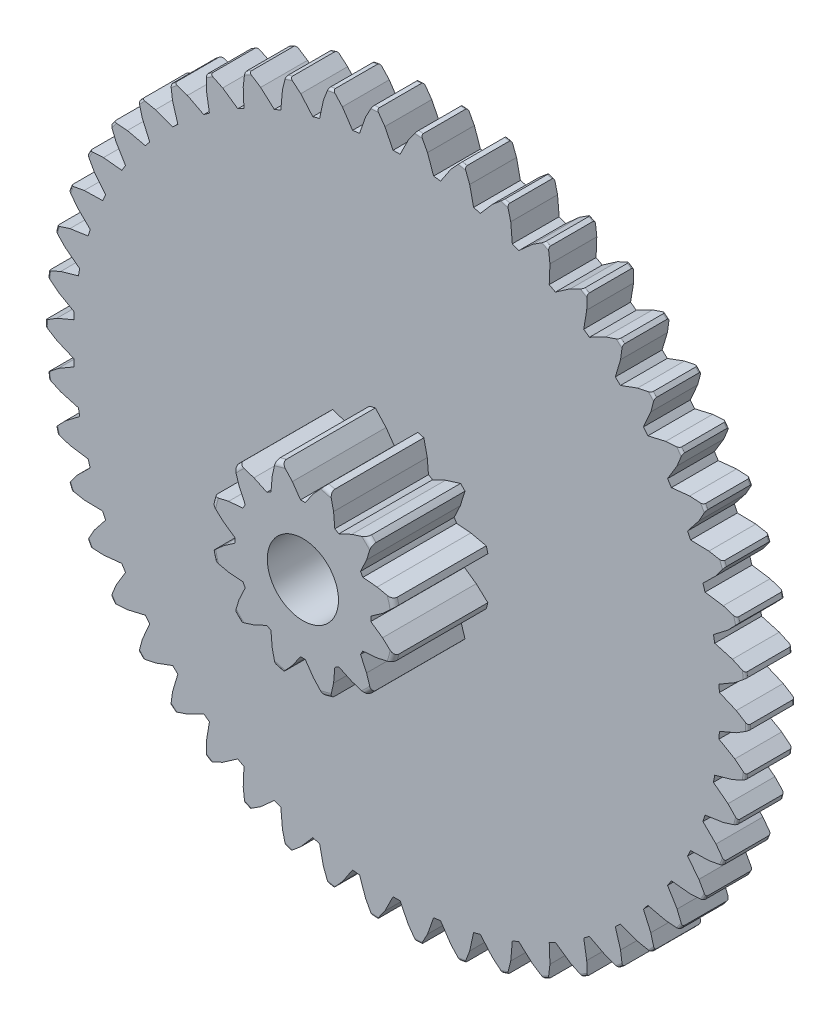
from build123d import *

# Parameters (mm, degrees)
CROQUIS1_R              = 7.5
SALIENTE_EXTRUIR1_DEPTH = 1
CROQUIS3_R              = 2
SALIENTE_EXTRUIR2_DEPTH = 2
CORTAR_EXTRUIR5_DEPTH   = 3
REDONDEO2_R             = 0.05
MATRIZC3_COUNT          = 50
CORTAR_EXTRUIR6_START   = -2
CORTAR_EXTRUIR6_DEPTH   = 2
REDONDEO1_R             = 0.1
MATRIZC4_COUNT          = 12
CROQUIS5_4_R            = 0.76
CORTAR_EXTRUIR8_DEPTH   = 3


with BuildPart() as part:
    # Croquis1 → Saliente-Extruir1 (new body)
    with BuildSketch(Plane.XY):
        Circle(CROQUIS1_R)
    extrude(amount=SALIENTE_EXTRUIR1_DEPTH)

    # Croquis3 → Saliente-Extruir2 (add)
    with BuildSketch(Plane.XY.offset(1)):
        Circle(CROQUIS3_R)
    extrude(amount=SALIENTE_EXTRUIR2_DEPTH)

    # Croquis4 → Cortar-Extruir5 (cut)
    with BuildSketch(Plane.XY.offset(3)):
        with BuildLine():
            Line((0.5, 7.6000000000000005), (-0.5, 7.6000000000000005))
            Line((-0.5, 7.6000000000000005), (-0.25, 7.25))
            Line((-0.25, 7.25), (-0.07500000000000001, 6.899592379264156))
            ThreePointArc((-0.07500000000000011, 6.8995923792641545), (4.2e-16, 6.9), (0.07499999999999943, 6.8995923792641545))
            Line((0.07500000000000001, 6.899592379264156), (0.25, 7.25))
            Line((0.25, 7.25), (0.5, 7.6000000000000005))
        make_face()
    cortar_extruir5 = extrude(amount=-CORTAR_EXTRUIR5_DEPTH, mode=Mode.SUBTRACT)

    # Redondeo2
    redondeo2_edges = [part.edges().sort_by_distance(p)[0] for p in [
        (-7.2e-16, -7.5, 0),
        (2.11e-15, -7.5, 1),
    ]]
    fillet(redondeo2_edges, radius=REDONDEO2_R)

    # MatrizC3: Cortar-Extruir5 ×50 about axis
    matrizc3_axis = Axis((0, 0, 1), (0, 0, -1))
    for i in range(1, MATRIZC3_COUNT):
        add(cortar_extruir5.rotate(matrizc3_axis, i * 360 / MATRIZC3_COUNT), mode=Mode.SUBTRACT)

    # Croquis5 → Cortar-Extruir6 (cut)
    with BuildSketch(Plane.XY.offset(3).offset(CORTAR_EXTRUIR6_START)):
        with BuildLine():
            ThreePointArc((-0.05000000000000001, 1.4491376746189437), (-1e-17, 1.4499999999999997), (0.04999999999999996, 1.449137674618944))
            Line((0.05, 1.4491376746189437), (0.22499999999999998, 1.7))
            Line((0.225, 1.7), (0.4524672880478463, 1.9481461324158322))
            ThreePointArc((0.4524672880478684, 1.9481461324157918), (-6e-17, 2), (-0.4524672880478684, 1.9481461324157916))
            Line((-0.4524672880478463, 1.9481461324158325), (-0.225, 1.7))
            Line((-0.22499999999999998, 1.7), (-0.05, 1.4491376746189437))
        make_face()
    cortar_extruir6 = extrude(amount=CORTAR_EXTRUIR6_DEPTH, mode=Mode.SUBTRACT)

    # Redondeo1
    redondeo1_edges = [part.edges().sort_by_distance(p)[0] for p in [
        (3.3e-16, -2, 3),
    ]]
    fillet(redondeo1_edges, radius=REDONDEO1_R)

    # MatrizC4: Cortar-Extruir6 ×12 about axis
    matrizc4_axis = Axis((0, 0, 3), (0, 0, -1))
    for i in range(1, MATRIZC4_COUNT):
        add(cortar_extruir6.rotate(matrizc4_axis, i * 360 / MATRIZC4_COUNT), mode=Mode.SUBTRACT)

    # Croquis5<4> → Cortar-Extruir8 (cut)
    with BuildSketch(Plane.XY.offset(3)):
        Circle(CROQUIS5_4_R)
    extrude(amount=-CORTAR_EXTRUIR8_DEPTH, mode=Mode.SUBTRACT)


solid = part.part
